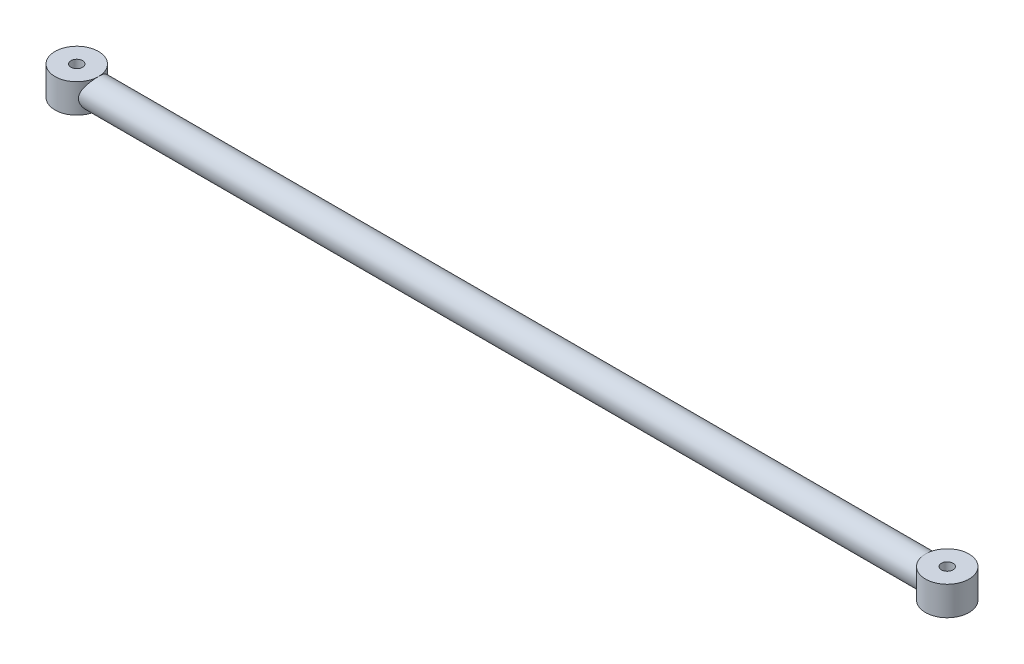
from build123d import *
from build123d.topology import SkipClean

# Parameters (mm, degrees)
SKETCH1_R                            = 7.5
SKETCH1_R_2                          = 2
BOSS_EXTRUDE1_DEPTH                  = 10
BOSS_EXTRUDE1_2_DEPTH                = 10
BOSS_EXTRUDE2_REACH                  = 159.995
BOSS_EXTRUDE2_END_RADIUS             = 7.5
SKETCH2_R                            = 5
BOSS_EXTRUDE2_DIRECTION_2_REACH      = 159.995
BOSS_EXTRUDE2_DIRECTION_2_END_RADIUS = 7.5


with BuildPart() as part:
    # Sketch1 → Boss-Extrude1 (new body)
    with BuildSketch(Plane(origin=(0, 0, 0), x_dir=(1, 0, 0), z_dir=(0, 1, 0))):
        Circle(SKETCH1_R)
        Circle(SKETCH1_R_2, mode=Mode.SUBTRACT)
    extrude(amount=BOSS_EXTRUDE1_DEPTH)



with BuildPart() as body_2:
    # Sketch1 → Boss-Extrude1 2 (new body)
    with BuildSketch(Plane(origin=(0, 0, 0), x_dir=(1, 0, 0), z_dir=(0, 1, 0))):
        with Locations((300, 0)):
            Circle(SKETCH1_R)
        with Locations((300, 0)):
            Circle(SKETCH1_R_2, mode=Mode.SUBTRACT)
    extrude(amount=BOSS_EXTRUDE1_2_DEPTH)


with BuildPart() as part_1:
    with SkipClean():  # the faces are left unmerged after this step: merging them gives an invalid solid
        add(part.part)

        add(body_2.part)  # Boss-Extrude2 merges body 2
        # Boss-Extrude2: up to this cylinder (the profile starts outside it)
        boss_extrude2_end = Plane(origin=(300, 5, 0), z_dir=(0, -1, 0)) * Cylinder(BOSS_EXTRUDE2_END_RADIUS, 335.99, mode=Mode.PRIVATE)
        # Sketch2 → Boss-Extrude2 (add, up to the surface)
        with BuildSketch(Plane(origin=(150, 0, 0), x_dir=(0, 0, -1), z_dir=(1, 0, 0)), mode=Mode.PRIVATE) as boss_extrude2_sk1:
            with Locations((0, 5)):
                Circle(SKETCH2_R)
        boss_extrude2_tool1 = extrude(boss_extrude2_sk1.sketch, amount=BOSS_EXTRUDE2_REACH, mode=Mode.PRIVATE) - boss_extrude2_end
        add(boss_extrude2_tool1.solids().sort_by_distance((150, 5, 0))[0])

    # Boss-Extrude2 direction 2: up to this cylinder (the profile starts outside it)
    boss_extrude2_direction_2_end = Plane(origin=(0, 5, 0), z_dir=(0, -1, 0)) * Cylinder(BOSS_EXTRUDE2_DIRECTION_2_END_RADIUS, 335.99, mode=Mode.PRIVATE)
    # Sketch2 → Boss-Extrude2 direction 2 (add, up to the surface)
    with BuildSketch(Plane(origin=(150, 0, 0), x_dir=(0, 0, -1), z_dir=(1, 0, 0)), mode=Mode.PRIVATE) as boss_extrude2_direction_2_sk1:
        with Locations((0, 5)):
            Circle(SKETCH2_R)
    boss_extrude2_direction_2_tool1 = extrude(boss_extrude2_direction_2_sk1.sketch, amount=-BOSS_EXTRUDE2_DIRECTION_2_REACH, mode=Mode.PRIVATE) - boss_extrude2_direction_2_end
    add(boss_extrude2_direction_2_tool1.solids().sort_by_distance((150, 5, 0))[0])


solid = part_1.part
